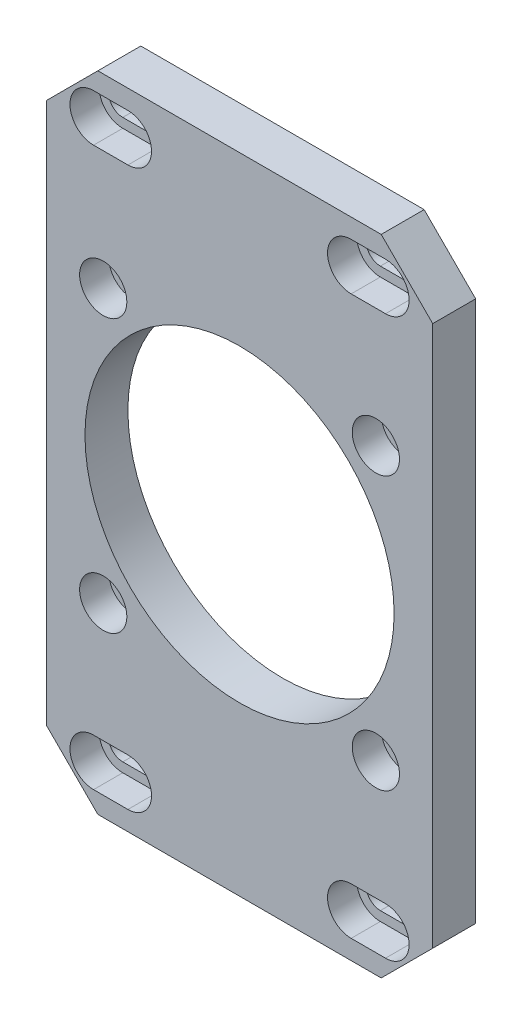
from build123d import *

# Parameters (mm, degrees)
SKETCH_1_W                = 90
SKETCH_1_H                = 150
EXTRUDE_1_DEPTH           = 5
SKETCH_4_R                = 36
CUT_EXTRUDE_1_DEPTH       = 89.034084308
HOLE_WIZARD_3_D           = 6.6
HOLE_WIZARD_3_CBORE_D     = 11
HOLE_WIZARD_3_CBORE_DEPTH = 6.8
HOLE_START                = -1.8
HOLE_WIZARD_2_DEPTH       = 6.8
HOLE_START_2              = -5
HOLE_WIZARD_2_2_DEPTH     = 3.2
CHAMFER_1_SIZE            = 12


# Read off the part's stored shape, not the designer's step: 打孔尺寸(%根据)内六角圆柱头螺钉的类型2
with BuildPart() as part:
    # 草图1 → 凸台-拉伸1 (new, symmetric)
    with BuildSketch(Plane.XY):
        Rectangle(SKETCH_1_W, SKETCH_1_H)
    extrude(amount=EXTRUDE_1_DEPTH, both=True)

    # 草图4 → 切除-拉伸1 (cut, through all)
    with BuildSketch(Plane.XY.offset(5)):
        Circle(SKETCH_4_R)
    extrude(amount=-CUT_EXTRUDE_1_DEPTH, mode=Mode.SUBTRACT)

    # 打孔尺寸(%根据)内六角圆柱头螺钉的类型3 (through all)
    with Locations(Plane(origin=(-31.75, 31.75, 5), x_dir=(1, 0, 0), z_dir=(0, 0, 1))):
        with Locations((0, 0), (63.5, 0), (0, -63.5), (63.5, -63.5)):
            CounterBoreHole(HOLE_WIZARD_3_D / 2, HOLE_WIZARD_3_CBORE_D / 2, HOLE_WIZARD_3_CBORE_DEPTH)

    # 打孔尺寸(%根据)内六角圆柱头螺钉的类型2 outline → 打孔尺寸(%根据)内六角圆柱头螺钉的类型2 (cut)
    with BuildSketch(Plane.XY.offset(HOLE_START)):
        with BuildLine():
            Line((-34, 59.5), (-26, 59.5))
            ThreePointArc((-26, 59.5), (-20.5, 65), (-26, 70.5))
            Line((-26, 70.5), (-34, 70.5))
            ThreePointArc((-34, 70.5), (-39.5, 65), (-34, 59.5))
        make_face()
        with BuildLine():
            ThreePointArc((34, 59.5), (39.5, 65), (34, 70.5))
            Line((34, 70.5), (26, 70.5))
            ThreePointArc((26, 70.5), (20.5, 65), (26, 59.5))
            Line((26, 59.5), (34, 59.5))
        make_face()
        with BuildLine():
            Line((-34, -70.5), (-26, -70.5))
            ThreePointArc((-26, -70.5), (-20.5, -65), (-26, -59.5))
            Line((-26, -59.5), (-34, -59.5))
            ThreePointArc((-34, -59.5), (-39.5, -65), (-34, -70.5))
        make_face()
        with BuildLine():
            ThreePointArc((34, -70.5), (39.5, -65), (34, -59.5))
            Line((34, -59.5), (26, -59.5))
            ThreePointArc((26, -59.5), (20.5, -65), (26, -70.5))
            Line((26, -70.5), (34, -70.5))
        make_face()
    extrude(amount=HOLE_WIZARD_2_DEPTH, mode=Mode.SUBTRACT)

    # Hole Wizard 2 2 outline → Hole Wizard 2 2 (cut)
    with BuildSketch(Plane.XY.offset(HOLE_START_2)):
        with BuildLine():
            Line((-34, 61.7), (-26, 61.7))
            ThreePointArc((-26, 61.7), (-22.7, 65), (-26, 68.3))
            Line((-26, 68.3), (-34, 68.3))
            ThreePointArc((-34, 68.3), (-37.3, 65), (-34, 61.7))
        make_face()
        with BuildLine():
            ThreePointArc((34, 61.7), (37.3, 65), (34, 68.3))
            Line((34, 68.3), (26, 68.3))
            ThreePointArc((26, 68.3), (22.7, 65), (26, 61.7))
            Line((26, 61.7), (34, 61.7))
        make_face()
        with BuildLine():
            Line((-34, -68.3), (-26, -68.3))
            ThreePointArc((-26, -68.3), (-22.7, -65), (-26, -61.7))
            Line((-26, -61.7), (-34, -61.7))
            ThreePointArc((-34, -61.7), (-37.3, -65), (-34, -68.3))
        make_face()
        with BuildLine():
            ThreePointArc((34, -68.3), (37.3, -65), (34, -61.7))
            Line((34, -61.7), (26, -61.7))
            ThreePointArc((26, -61.7), (22.7, -65), (26, -68.3))
            Line((26, -68.3), (34, -68.3))
        make_face()
    extrude(amount=HOLE_WIZARD_2_2_DEPTH, mode=Mode.SUBTRACT)

    # 倒角1
    chamfer_1_edges = [part.edges().sort_by_distance(p)[0] for p in [
        (45, -75, 0),
        (-45, -75, 0),
        (-45, 75, 0),
        (45, 75, 0),
    ]]
    chamfer(chamfer_1_edges, length=CHAMFER_1_SIZE)


solid = part.part
